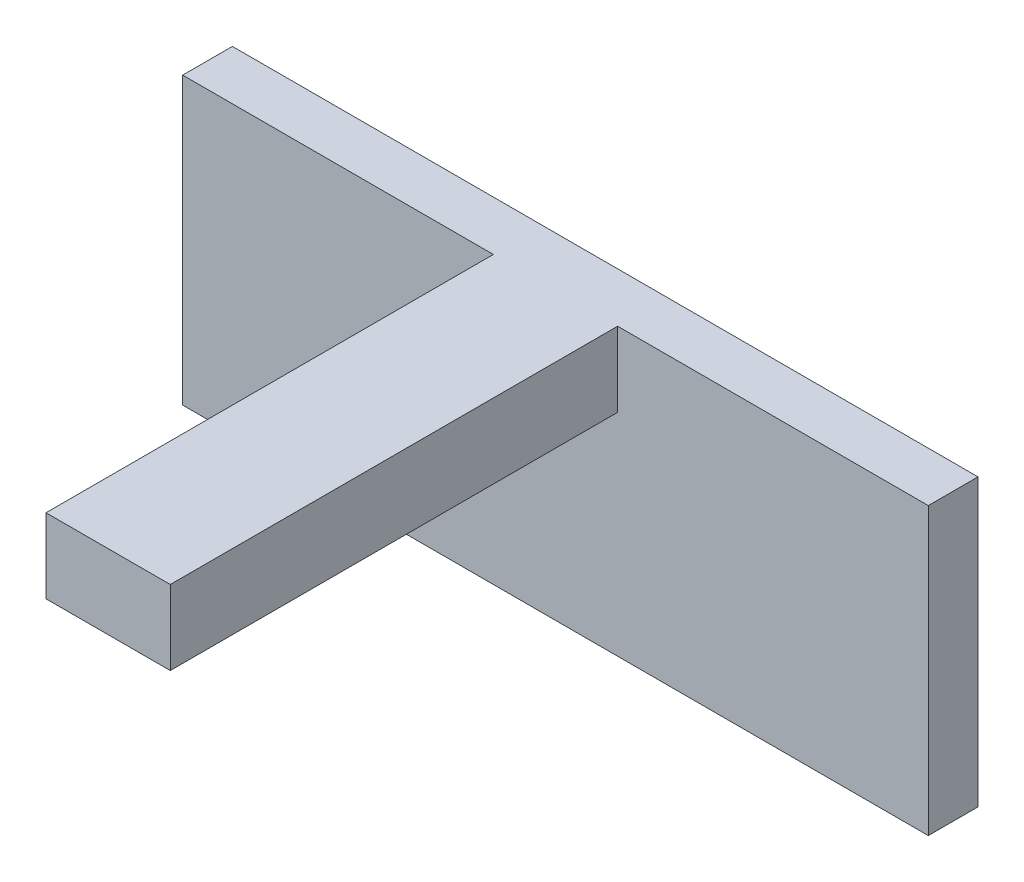
from build123d import *

# Parameters (mm, degrees)
SKETCH1_W           = 150
SKETCH1_H           = 50
BOSS_EXTRUDE1_DEPTH = 10
SKETCH2_W           = 25
SKETCH2_H           = 15
BOSS_EXTRUDE2_DEPTH = 90
SKETCH5_W           = 150
SKETCH5_H           = 10
BOSS_EXTRUDE3_DEPTH = 7.5


with BuildPart() as part:
    # Sketch1 → Boss-Extrude1 (new body)
    with BuildSketch(Plane.XY):
        Rectangle(SKETCH1_W, SKETCH1_H)
    extrude(amount=BOSS_EXTRUDE1_DEPTH)

    # Sketch2 → Boss-Extrude2 (add)
    with BuildSketch(Plane.XY.offset(10)):
        with Locations((0, 25)):
            Rectangle(SKETCH2_W, SKETCH2_H)
    extrude(amount=BOSS_EXTRUDE2_DEPTH)

    # Cut-Loft3: read off the stored shape, not the designer's step
    # Cut-Loft3: loft between two sections, ruled curve by curve
    cut_loft3_from = [
        Edge.make_bspline([(-3.437683222, 17.5, 85.082446333), (-13.272790555, 17.5, 91.957812777), (-6.397424111, 17.5, 101.792920111), (3.437683222, 17.5, 94.917553667), (13.272790555, 17.5, 88.042187223), (6.397424111, 17.5, 78.207079889), (-3.437683222, 17.5, 85.082446333)], [0, 0, 0, 0, 0.5, 0.5, 0.5, 1, 1, 1, 1], 3, [1, 0.333333333, 0.333333333, 1, 0.333333333, 0.333333333, 1]),
    ]
    cut_loft3_to = [
        Edge.make_bspline([(0, 23.5, 85), (-10, 23.5, 85), (-10, 23.5, 95), (0, 23.5, 95), (10, 23.5, 95), (10, 23.5, 85), (0, 23.5, 85)], [0, 0, 0, 0, 0.5, 0.5, 0.5, 1, 1, 1, 1], 3, [1, 0.333333333, 0.333333333, 1, 0.333333333, 0.333333333, 1]),
    ]
    cut_loft3 = Solid(Shell([*[Face.make_surface_from_curves(cut_loft3_from[k], cut_loft3_to[k]) for k in range(1)], Face(Wire(cut_loft3_from)), Face(Wire(cut_loft3_to))]))
    add(cut_loft3, mode=Mode.SUBTRACT)

    # Sketch5 → Boss-Extrude3 (add)
    with BuildSketch(Plane(origin=(0, 25, 0), x_dir=(1, 0, 0), z_dir=(0, 1, 0))):
        with Locations((0, -5)):
            Rectangle(SKETCH5_W, SKETCH5_H)
    extrude(amount=BOSS_EXTRUDE3_DEPTH)


solid = part.part
